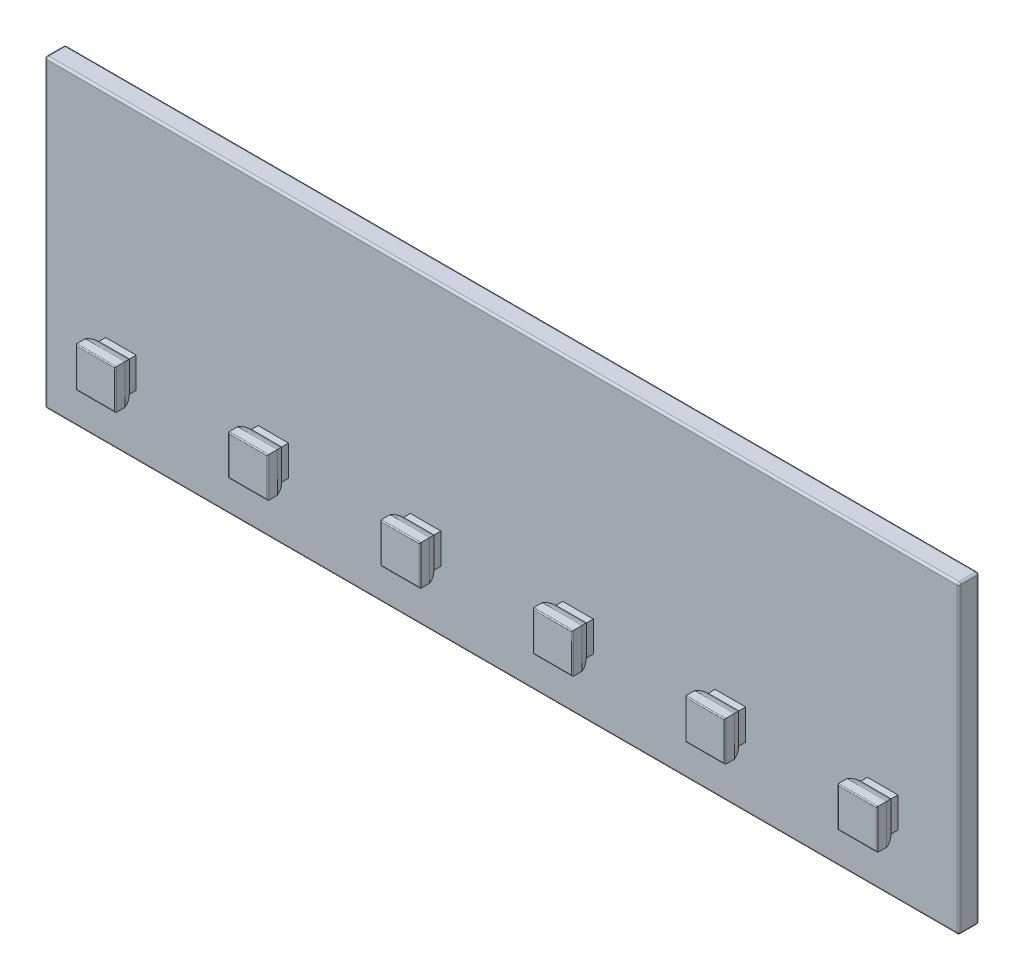
from build123d import *

# Parameters (mm, degrees)
SKETCH_1_W                      = 90
SKETCH_1_H                      = 30
EXTRUDE_1_DEPTH                 = 2
SKETCH_2_W                      = 3
SKETCH_2_H                      = 3
EXTRUDE_2_DEPTH                 = 1
EXTRUDE_3_DEPTH                 = 2
CUT_EXTRUDE_1_REACH             = 87.55
CUT_EXTRUDE_1_DIRECTION_2_REACH = 87.55
FILLET_1_R                      = 0.1
FILLET_1_OF_MIRROR_1_R          = 0.1
FILLET_1_OF_MIRROR_3_R          = 0.1
FILLET_2_R                      = 0.2


# Read off the part's stored shape, not the designer's step: 镜向4
with BuildPart() as part:
    # 草图1 → 凸台-拉伸1 (new body)
    with BuildSketch(Plane.XY):
        with Locations((37.5, 7.5)):
            Rectangle(SKETCH_1_W, SKETCH_1_H)
    extrude(amount=-EXTRUDE_1_DEPTH)

    # 草图2 → 凸台-拉伸2 (add)
    with BuildSketch(Plane.XY):
        Rectangle(SKETCH_2_W, SKETCH_2_H)
    extrude_2 = extrude(amount=EXTRUDE_2_DEPTH)

    # 草图3 → 凸台-拉伸3 (add, symmetric)
    with BuildSketch(Plane(origin=(0, 0, 0), x_dir=(1, 0, 0), z_dir=(0, 1, 0))):
        with BuildLine():
            Line((-1.95, -2.5), (1.95, -2.5))
            Line((1.95, -2.5), (1.95, -1.555590279))
            ThreePointArc((1.95, -1.555590279), (1.780042303, -1.088161527), (1.5, -0.677124344))
            Line((1.5, -0.677124344), (-1.5, -0.677124344))
            ThreePointArc((-1.5, -0.677124344), (-1.780042303, -1.088161527), (-1.95, -1.555590279))
            Line((-1.95, -1.555590279), (-1.95, -2.5))
        make_face()
    extrude_3 = extrude(amount=EXTRUDE_3_DEPTH, both=True)

    # 草图4 → 切除-拉伸1 (cut, up to next)
    with BuildSketch(Plane(origin=(0, 0, 0), x_dir=(0, 0, -1), z_dir=(1, 0, 0)), mode=Mode.PRIVATE) as cut_extrude_1_sk1:
        with BuildLine():
            Line((-2.5, 1.95), (-1.555590279, 1.95))
            ThreePointArc((-1.555590279, 1.95), (-1.088161527, 1.780042303), (-0.677124344, 1.5))
            Line((-0.677124344, 1.5), (-0.677124344, 2))
            Line((-0.677124344, 2), (-2.5, 2))
            Line((-2.5, 2), (-2.5, 1.95))
        make_face()
    cut_extrude_1_tool1 = extrude(cut_extrude_1_sk1.sketch, amount=-CUT_EXTRUDE_1_REACH, mode=Mode.PRIVATE) & part.part
    # 草图4 → 切除-拉伸1 (cut, up to next)
    with BuildSketch(Plane(origin=(0, 0, 0), x_dir=(0, 0, -1), z_dir=(1, 0, 0)), mode=Mode.PRIVATE) as cut_extrude_1_sk2:
        with BuildLine():
            Line((-2.5, -2), (-0.677124344, -2))
            Line((-0.677124344, -2), (-0.677124344, -1.5))
            ThreePointArc((-0.677124344, -1.5), (-1.088161527, -1.780042303), (-1.555590279, -1.95))
            Line((-1.555590279, -1.95), (-2.5, -1.95))
            Line((-2.5, -1.95), (-2.5, -2))
        make_face()
    cut_extrude_1_tool2 = extrude(cut_extrude_1_sk2.sketch, amount=-CUT_EXTRUDE_1_REACH, mode=Mode.PRIVATE) & part.part
    cut_extrude_1_1 = cut_extrude_1_tool1.solids().sort_by_distance((0, 1.873038, 1.175075))[0]
    add(cut_extrude_1_1, mode=Mode.SUBTRACT)
    cut_extrude_1_2 = cut_extrude_1_tool2.solids().sort_by_distance((0, -1.873038, 1.175075))[0]
    add(cut_extrude_1_2, mode=Mode.SUBTRACT)
    cut_extrude_1 = cut_extrude_1_1 + cut_extrude_1_2  # 切除-拉伸1 as one shape, for the pattern or mirror that repeats it

    # 草图4 → 切除-拉伸1 direction 2 (cut, up to next)
    with BuildSketch(Plane(origin=(0, 0, 0), x_dir=(0, 0, -1), z_dir=(1, 0, 0)), mode=Mode.PRIVATE) as cut_extrude_1_direction_2_sk1:
        with BuildLine():
            Line((-2.5, 1.95), (-1.555590279, 1.95))
            ThreePointArc((-1.555590279, 1.95), (-1.088161527, 1.780042303), (-0.677124344, 1.5))
            Line((-0.677124344, 1.5), (-0.677124344, 2))
            Line((-0.677124344, 2), (-2.5, 2))
            Line((-2.5, 2), (-2.5, 1.95))
        make_face()
    cut_extrude_1_direction_2_tool1 = extrude(cut_extrude_1_direction_2_sk1.sketch, amount=CUT_EXTRUDE_1_DIRECTION_2_REACH, mode=Mode.PRIVATE) & part.part
    # 草图4 → 切除-拉伸1 direction 2 (cut, up to next)
    with BuildSketch(Plane(origin=(0, 0, 0), x_dir=(0, 0, -1), z_dir=(1, 0, 0)), mode=Mode.PRIVATE) as cut_extrude_1_direction_2_sk2:
        with BuildLine():
            Line((-2.5, -2), (-0.677124344, -2))
            Line((-0.677124344, -2), (-0.677124344, -1.5))
            ThreePointArc((-0.677124344, -1.5), (-1.088161527, -1.780042303), (-1.555590279, -1.95))
            Line((-1.555590279, -1.95), (-2.5, -1.95))
            Line((-2.5, -1.95), (-2.5, -2))
        make_face()
    cut_extrude_1_direction_2_tool2 = extrude(cut_extrude_1_direction_2_sk2.sketch, amount=CUT_EXTRUDE_1_DIRECTION_2_REACH, mode=Mode.PRIVATE) & part.part
    cut_extrude_1_direction_2_1 = cut_extrude_1_direction_2_tool1.solids().sort_by_distance((0, 1.873038, 1.175075))[0]
    add(cut_extrude_1_direction_2_1, mode=Mode.SUBTRACT)
    cut_extrude_1_direction_2_2 = cut_extrude_1_direction_2_tool2.solids().sort_by_distance((0, -1.873038, 1.175075))[0]
    add(cut_extrude_1_direction_2_2, mode=Mode.SUBTRACT)
    cut_extrude_1_direction_2 = cut_extrude_1_direction_2_1 + cut_extrude_1_direction_2_2  # 切除-拉伸1 direction 2 as one shape, for the pattern or mirror that repeats it

    # 圆角1
    fillet_1_edges = [part.edges().sort_by_distance(p)[0] for p in [
        (-1.95, 0, 2.5),
        (1.95, 0, 2.5),
        (0, -1.95, 2.5),
        (0, 1.95, 2.5),
    ]]
    fillet(fillet_1_edges, radius=FILLET_1_R)

    # 镜向1: 凸台-拉伸2, 凸台-拉伸3, 切除-拉伸1, 切除-拉伸1 direction 2 across plane
    add(extrude_2.mirror(Plane(origin=(7.5, 0, 0), x_dir=(0, 0, 1), z_dir=(1, 0, 0))))
    add(extrude_3.mirror(Plane(origin=(7.5, 0, 0), x_dir=(0, 0, 1), z_dir=(1, 0, 0))))
    add(cut_extrude_1.mirror(Plane(origin=(7.5, 0, 0), x_dir=(0, 0, 1), z_dir=(1, 0, 0))), mode=Mode.SUBTRACT)
    add(cut_extrude_1_direction_2.mirror(Plane(origin=(7.5, 0, 0), x_dir=(0, 0, 1), z_dir=(1, 0, 0))), mode=Mode.SUBTRACT)

    # 圆角1 of 镜向1
    fillet_1_of_mirror_1_edges = [part.edges().sort_by_distance(p)[0] for p in [
        (16.95, 0, 2.5),
        (13.05, 0, 2.5),
        (15, -1.95, 2.5),
        (15, 1.95, 2.5),
    ]]
    fillet(fillet_1_of_mirror_1_edges, radius=FILLET_1_OF_MIRROR_1_R)

    # 镜向3: 凸台-拉伸2, 凸台-拉伸3, 切除-拉伸1, 切除-拉伸1 direction 2 across plane
    add(extrude_2.mirror(Plane(origin=(15, 0, 0), x_dir=(0, 0, 1), z_dir=(1, 0, 0))))
    add(extrude_3.mirror(Plane(origin=(15, 0, 0), x_dir=(0, 0, 1), z_dir=(1, 0, 0))))
    add(cut_extrude_1.mirror(Plane(origin=(15, 0, 0), x_dir=(0, 0, 1), z_dir=(1, 0, 0))), mode=Mode.SUBTRACT)
    add(cut_extrude_1_direction_2.mirror(Plane(origin=(15, 0, 0), x_dir=(0, 0, 1), z_dir=(1, 0, 0))), mode=Mode.SUBTRACT)

    # 圆角1 of 镜向3
    fillet_1_of_mirror_3_edges = [part.edges().sort_by_distance(p)[0] for p in [
        (31.95, 0, 2.5),
        (28.05, 0, 2.5),
        (30, -1.95, 2.5),
        (30, 1.95, 2.5),
    ]]
    fillet(fillet_1_of_mirror_3_edges, radius=FILLET_1_OF_MIRROR_3_R)

    # 镜向4: part across plane


with BuildPart() as part_1:
    add(part.part)
    add(part.part.mirror(Plane(origin=(37.5, 0, 0), x_dir=(0, 0, 1), z_dir=(1, 0, 0))))

    # 圆角2
    fillet_2_edges = [part_1.edges().sort_by_distance(p)[0] for p in [
        (82.5, 7.5, -2),
        (37.5, 22.5, -2),
        (-7.5, 7.5, -2),
        (37.5, 22.5, 0),
        (82.5, 7.5, 0),
        (37.5, -7.5, 0),
        (-7.5, 7.5, 0),
        (37.5, -7.5, -2),
        (-7.5, 22.5, -1),
        (82.5, 22.5, -1),
        (82.5, -7.5, -1),
        (-7.5, -7.5, -1),
    ]]
    fillet(fillet_2_edges, radius=FILLET_2_R)


solid = part_1.part
